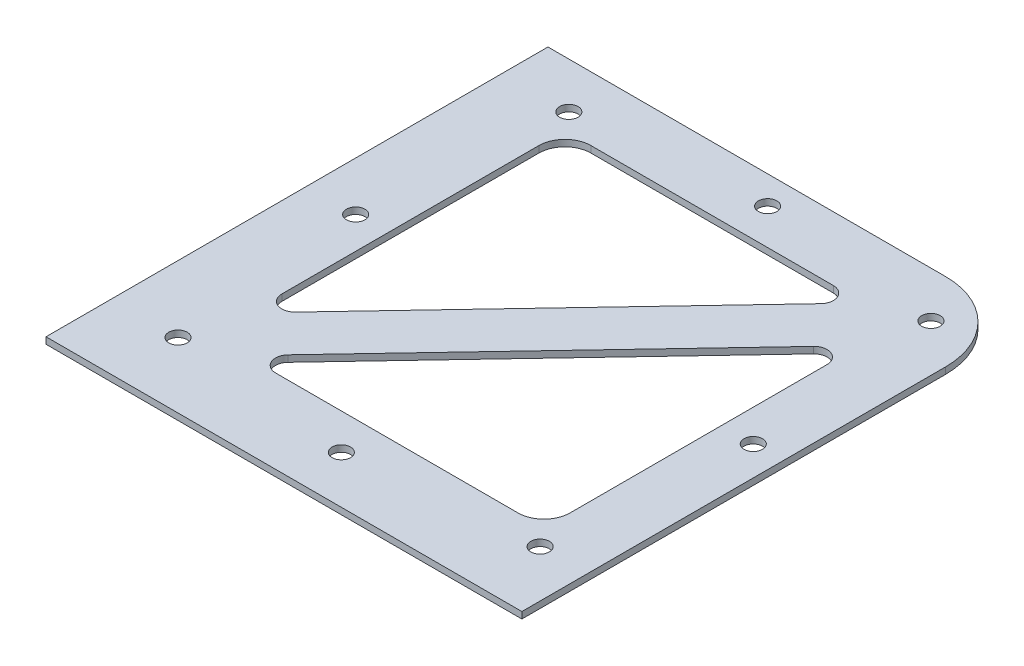
from build123d import *

# Parameters (mm, degrees)
SKETCH2_W            = 115.8875
SKETCH2_H            = 122.2375
BOSS_EXTRUDE4_DEPTH  = 1.5875
M4_CLEARANCE_HOLE1_D = 4.5
FILLET1_R            = 19.05
FILLET2_R            = 6.35
FILLET3_R            = 3.175


with BuildPart() as part:
    # Sketch2 → Boss-Extrude4 (new body)
    with BuildSketch(Plane(origin=(0, 0, 0), x_dir=(1, 0, 0), z_dir=(0, 1, 0))):
        with Locations((-95.437748261, 114.593960112)):
            Rectangle(SKETCH2_W, SKETCH2_H)
        Polygon((-133.696498261, 83.253322171), (-133.696498261, 160.155210112), (-60.951469128, 160.155210112), align=None, mode=Mode.SUBTRACT)
        Polygon((-52.416498261, 73.795210112), (-125.161527393, 73.795210112), (-52.416498261, 150.697098052), align=None, mode=Mode.SUBTRACT)
    extrude(amount=BOSS_EXTRUDE4_DEPTH)

    # M4 Clearance Hole1 (through all)
    with Locations(Plane(origin=(0, 1.5875, 0), x_dir=(1, 0, 0), z_dir=(0, 1, 0))):
        with Locations((-93.056498261, 65.065510112), (-137.14786851, 69.38383987), (-141.466198251, 116.975210121), (-137.147868492, 164.56658037), (-93.056498242, 168.884910112), (-48.965127993, 164.566580353), (-44.646798251, 116.975210102), (-48.965128011, 69.383839853)):
            Hole(M4_CLEARANCE_HOLE1_D / 2)

    # Fillet1
    fillet1_edges = [part.edges().sort_by_distance(p)[0] for p in [
        (-37.493998261, 0.79375, -175.712710112),
    ]]
    fillet(fillet1_edges, radius=FILLET1_R)

    # Fillet2
    fillet2_edges = [part.edges().sort_by_distance(p)[0] for p in [
        (-52.416498261, 0.79375, -73.795210112),
        (-133.696498261, 0.79375, -160.155210112),
    ]]
    fillet(fillet2_edges, radius=FILLET2_R)

    # Fillet3
    fillet3_edges = [part.edges().sort_by_distance(p)[0] for p in [
        (-52.416498261, 0.79375, -150.697098052),
        (-125.161527393, 0.79375, -73.795210112),
        (-133.696498261, 0.79375, -83.253322171),
        (-60.951469128, 0.79375, -160.155210112),
    ]]
    fillet(fillet3_edges, radius=FILLET3_R)


solid = part.part
